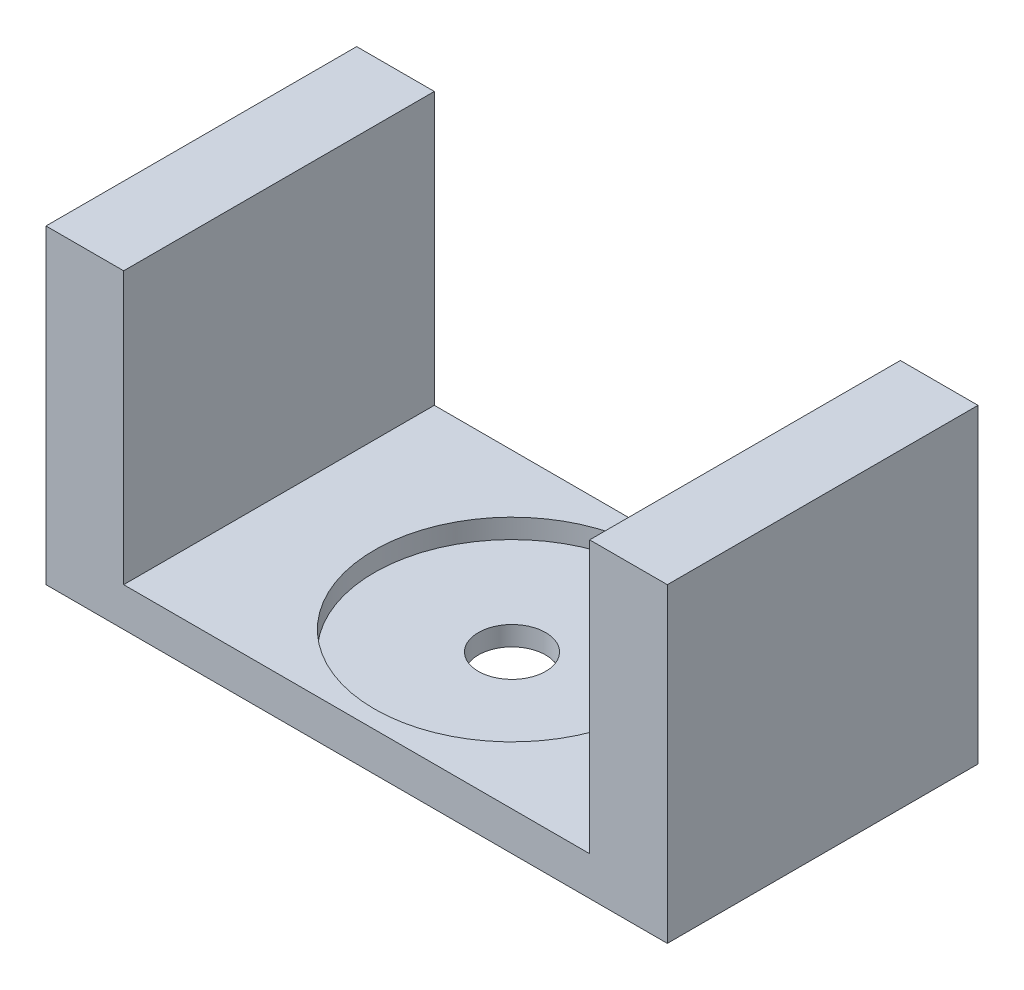
from build123d import *

# Parameters (mm, degrees)
BOSS_EXTRUDE1_DEPTH = 50.8
SKETCH2_R           = 22.5044
CUT_EXTRUDE1_DEPTH  = 3.175
SKETCH3_R           = 5.5
CUT_EXTRUDE2_DEPTH  = 87.194086949


with BuildPart() as part:
    # Sketch1 → Boss-Extrude1 (new body)
    with BuildSketch(Plane.XY):
        Polygon((50.8, 0), (-50.8, 0), (-50.8, 50.8), (-38.1, 50.8), (-38.1, 6.35), (38.1, 6.35), (38.1, 50.8), (50.8, 50.8), align=None)
    extrude(amount=BOSS_EXTRUDE1_DEPTH)

    # Sketch2 → Cut-Extrude1 (cut)
    with BuildSketch(Plane(origin=(0, 6.35, 0), x_dir=(1, 0, 0), z_dir=(0, 1, 0))):
        with Locations((0, -25.4)):
            Circle(SKETCH2_R)
    extrude(amount=-CUT_EXTRUDE1_DEPTH, mode=Mode.SUBTRACT)

    # Sketch3 → Cut-Extrude2 (cut, through all)
    with BuildSketch(Plane(origin=(0, 3.175, 0), x_dir=(1, 0, 0), z_dir=(0, 1, 0))):
        with Locations((0, -25.4)):
            Circle(SKETCH3_R)
    extrude(amount=-CUT_EXTRUDE2_DEPTH, mode=Mode.SUBTRACT)


solid = part.part
